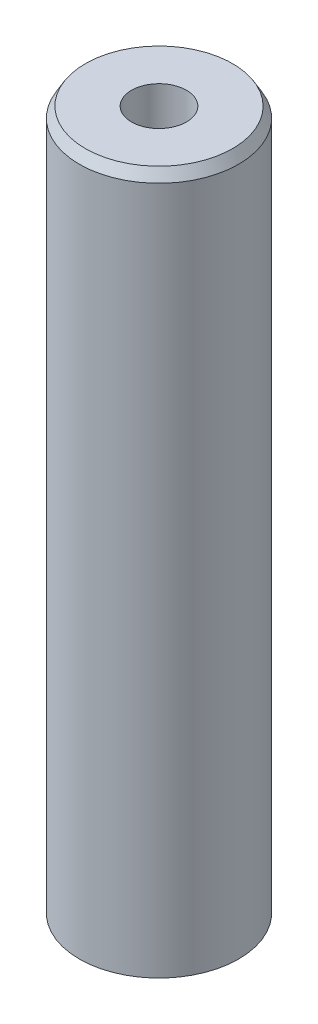
from build123d import *
from OCP.BRepFilletAPI import BRepFilletAPI_MakeChamfer

# Parameters (mm, degrees)
SKETCH1_R           = 25
BOSS_EXTRUDE1_DEPTH = 221.129842444
SKETCH2_R           = 8.627350073
CUT_EXTRUDE1_DEPTH  = 224.938400501
CHAMFER1_SIZE       = 3.294172573
CHAMFER1_SIZE2      = 1.901891422


with BuildPart() as part:
    # Sketch1 → Boss-Extrude1 (new body)
    with BuildSketch(Plane(origin=(0, 0, 0), x_dir=(1, 0, 0), z_dir=(0, 1, 0))):
        Circle(SKETCH1_R)
    extrude(amount=BOSS_EXTRUDE1_DEPTH)

    # Sketch2 → Cut-Extrude1 (cut, through all)
    with BuildSketch(Plane(origin=(0, 0, 0), x_dir=(1, 0, 0), z_dir=(0, 1, 0))):
        Circle(SKETCH2_R)
    extrude(amount=CUT_EXTRUDE1_DEPTH, mode=Mode.SUBTRACT)

    # Chamfer1: one chamfer whose edges measure the first distance from different faces: ONE call of the kernel's chamfer builder (chamfer() names one face for all edges)
    chamfer1_edges_1 = [part.edges().sort_by_distance(p)[0] for p in [
        (-25, 221.129842444, 0),
    ]]
    chamfer1_side_1 = [part.faces().sort_by_distance(p)[0] for p in [
        (-25, 110.564921222, 0),
    ]]
    chamfer1_edges_2 = [part.edges().sort_by_distance(p)[0] for p in [
        (-25, 0, 0),
    ]]
    chamfer1_side_2 = [part.faces().sort_by_distance(p)[0] for p in [
        (-24.292893219, 0, 0),
    ]]
    chamfer1 = BRepFilletAPI_MakeChamfer(part.part.solid().wrapped)
    for e in chamfer1_edges_1:
        chamfer1.Add(CHAMFER1_SIZE, CHAMFER1_SIZE2, e.wrapped, chamfer1_side_1[0].wrapped)  # the first distance lies on this face
    for e in chamfer1_edges_2:
        chamfer1.Add(CHAMFER1_SIZE, CHAMFER1_SIZE2, e.wrapped, chamfer1_side_2[0].wrapped)  # the first distance lies on this face
    add(Compound.cast(chamfer1.Shape()), mode=Mode.REPLACE)


solid = part.part
